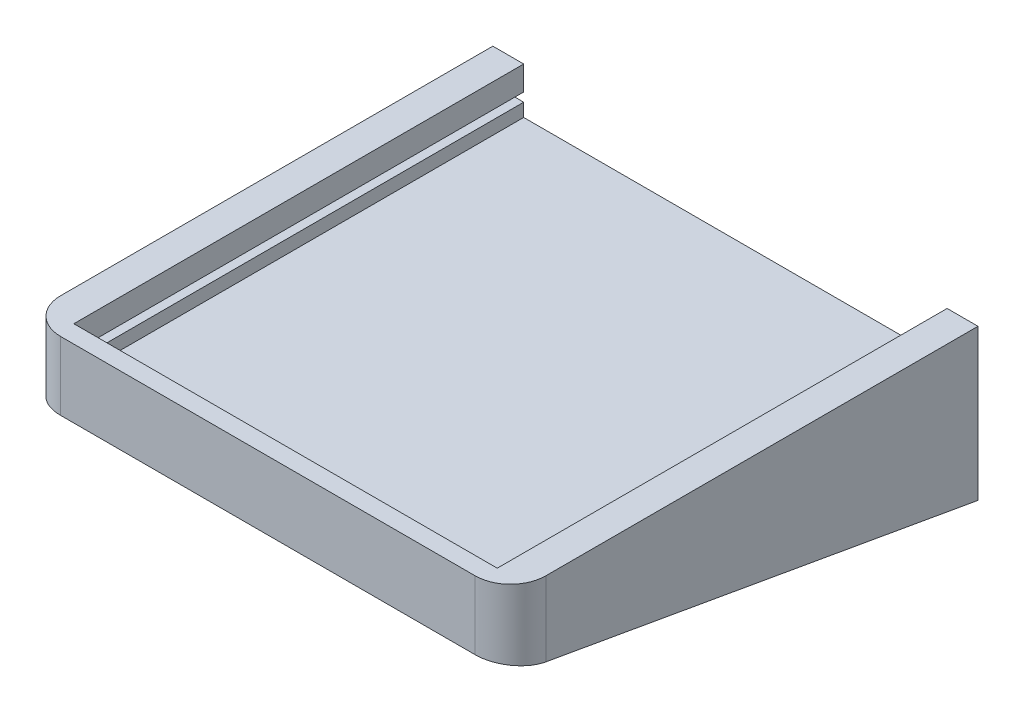
from build123d import *

# Parameters (mm, degrees)
ESQUISSE2_W             = 110
ESQUISSE2_H             = 106
BOSS_EXTRU_3_DEPTH      = 5
BOSS_EXTRU_4_DEPTH      = 3
BOSS_EXTRU_5_DEPTH      = 2
BOSS_EXTRU_6_DEPTH      = 5.5
BOSS_EXTRU_7_DEPTH      = 110
ESQUISSE7_R             = 2.35
ENL_V_MAT_EXTRU_1_DEPTH = 4
CONG_3_R                = 8
ENL_V_MAT_EXTRU_2_DEPTH = 4


with BuildPart() as part:
    # Esquisse2 → Boss.-Extru.3 (new body)
    with BuildSketch(Plane(origin=(0, 0, 0), x_dir=(1, 0, 0), z_dir=(0, 1, 0))):
        with Locations((55, 53)):
            Rectangle(ESQUISSE2_W, ESQUISSE2_H)
    extrude(amount=BOSS_EXTRU_3_DEPTH)

    # Esquisse3 → Boss.-Extru.4 (add)
    with BuildSketch(Plane(origin=(0, 5, 0), x_dir=(1, 0, 0), z_dir=(0, 1, 0))):
        Polygon((7, 4), (7, 106), (0, 106), (0, 0), (110, 0), (110, 106), (103, 106), (103, 4), align=None)
    extrude(amount=BOSS_EXTRU_4_DEPTH)

    # Esquisse4 → Boss.-Extru.5 (add)
    with BuildSketch(Plane(origin=(0, 8, 0), x_dir=(1, 0, 0), z_dir=(0, 1, 0))):
        Polygon((4, 106), (4, 4), (106, 4), (106, 106), (110, 106), (110, 0), (0, 0), (0, 106), align=None)
    extrude(amount=BOSS_EXTRU_5_DEPTH)

    # Esquisse6 → Boss.-Extru.6 (add)
    with BuildSketch(Plane(origin=(0, 10, 0), x_dir=(1, 0, 0), z_dir=(0, 1, 0))):
        Polygon((0, 106), (7, 106), (7, 4), (103, 4), (103, 106), (110, 106), (110, 4), (110, 0), (0, 0), (0, 4), align=None)
    extrude(amount=BOSS_EXTRU_6_DEPTH)

    # Esquisse8 → Boss.-Extru.7 (add)
    with BuildSketch(Plane(origin=(110, 0, 0), x_dir=(0, 0, -1), z_dir=(1, 0, 0))):
        Polygon((0, 0), (106, 0), (106, -18.690659955), align=None)
    extrude(amount=-BOSS_EXTRU_7_DEPTH)

    # Esquisse7 → Enlèv. mat.-Extru.1 (cut)
    with BuildSketch(Plane(origin=(0, 0, -106), x_dir=(-1, 0, 0), z_dir=(0, 0, -1))):
        with Locations((-103, 0)):
            Circle(ESQUISSE7_R)
        with Locations((-7, 0)):
            Circle(ESQUISSE7_R)
    extrude(amount=-ENL_V_MAT_EXTRU_1_DEPTH, mode=Mode.SUBTRACT)

    # Congé3
    cong_3_edges = [part.edges().sort_by_distance(p)[0] for p in [
        (110, 7.75, 0),
        (0, 7.75, 0),
    ]]
    fillet(cong_3_edges, radius=CONG_3_R)

    # Esquisse9 → Enlèv. mat.-Extru.2 (cut)
    with BuildSketch(Plane(origin=(0, 0, 0), x_dir=(1, 0, 0), z_dir=(0, -0.9848077530122092, 0.17364817766692348))):
        with BuildLine():
            Line((14, -8), (96, -8))
            ThreePointArc((96, -8), (100.242640687, -9.757359313), (102, -14))
            Line((102, -14), (102, -97.63522086))
            ThreePointArc((102, -97.63522086), (100.242640687, -101.877861547), (96, -103.63522086))
            Line((96, -103.63522086), (14, -103.63522086))
            ThreePointArc((14, -103.63522086), (9.757359313, -101.877861547), (8, -97.63522086))
            Line((8, -97.63522086), (8, -14))
            ThreePointArc((8, -14), (9.757359313, -9.757359313), (14, -8))
        make_face()
    extrude(amount=-ENL_V_MAT_EXTRU_2_DEPTH, mode=Mode.SUBTRACT)


solid = part.part
